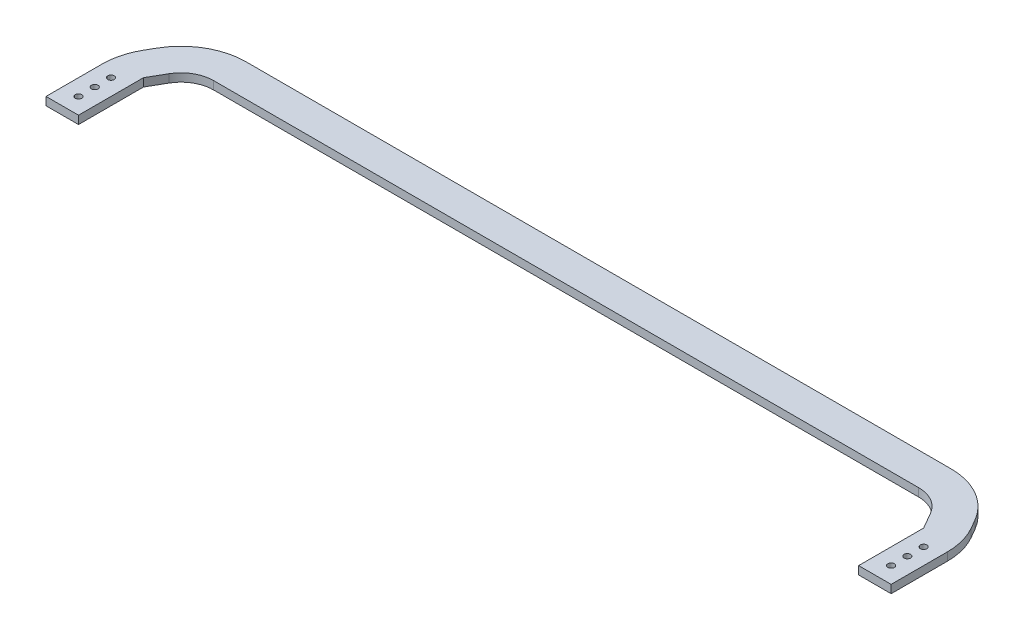
from build123d import *

# Parameters (mm, degrees)
BOSS_EXTRUDE1_DEPTH    = 6.35
F_10_CLEARANCE_HOLE1_D = 5.1054


with BuildPart() as part:
    # Sketch1 → Boss-Extrude1 (new body)
    with BuildSketch(Plane(origin=(0, 0, 0), x_dir=(1, 0, 0), z_dir=(0, 1, 0))):
        with BuildLine():
            Line((-304.8, -50.8), (-304.8, 0))
            Line((-304.8, 0), (-297.467651581, 12.7))
            ThreePointArc((-297.467651581, 12.7), (-288.170606325, 21.997045256), (-275.470606325, 25.4))
            Line((-275.470606325, 25.4), (275.470606325, 25.4))
            ThreePointArc((275.470606325, 25.4), (288.170606325, 21.997045256), (297.467651581, 12.7))
            Line((297.467651581, 12.7), (304.8, 0))
            Line((304.8, 0), (304.8, -50.8))
            Line((304.8, -50.8), (330.2, -50.8))
            Line((330.2, -50.8), (330.2, -6.805909488))
            ThreePointArc((330.2, -6.805909488), (328.469031975, 6.342098003), (323.394090512, 18.594090512))
            Line((323.394090512, 18.594090512), (319.464696837, 25.4))
            ThreePointArc((319.464696837, 25.4), (300.870606325, 43.994090512), (275.470606325, 50.8))
            Line((275.470606325, 50.8), (-275.470606325, 50.8))
            ThreePointArc((-275.470606325, 50.8), (-300.870606325, 43.994090512), (-319.464696837, 25.4))
            Line((-319.464696837, 25.4), (-323.394090512, 18.594090512))
            ThreePointArc((-323.394090512, 18.594090512), (-328.469031975, 6.342098003), (-330.2, -6.805909488))
            Line((-330.2, -6.805909488), (-330.2, -50.8))
            Line((-330.2, -50.8), (-304.8, -50.8))
        make_face()
    extrude(amount=BOSS_EXTRUDE1_DEPTH)

    # #10 Clearance Hole1 (through all)
    with Locations(Plane(origin=(0, 6.35, 0), x_dir=(1, 0, 0), z_dir=(0, 1, 0))):
        with Locations((-317.5, -38.1), (-317.5, -25.4), (-317.5, -12.7), (317.5, -12.7), (317.5, -25.4), (317.5, -38.1)):
            Hole(F_10_CLEARANCE_HOLE1_D / 2)


solid = part.part
